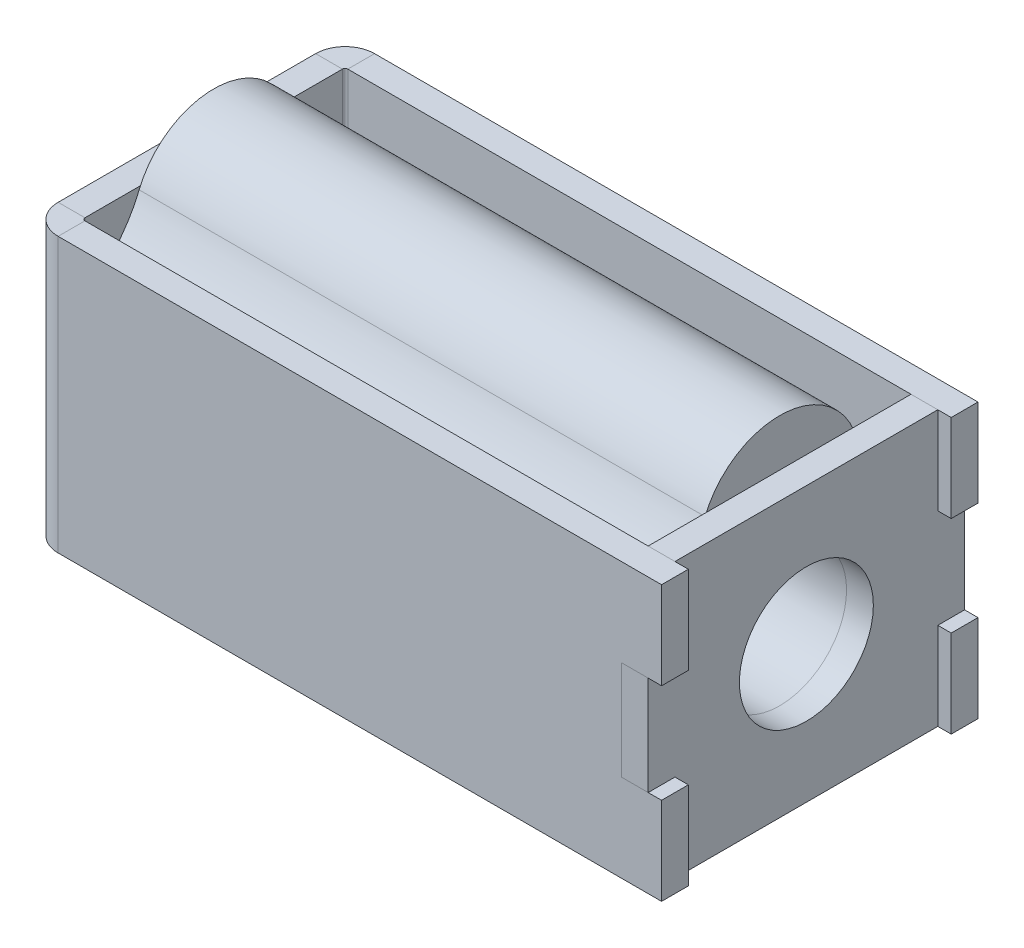
from build123d import *

# Parameters (mm, degrees)
T_LE_DE_BASE_PLI_E1_DEPTH = 6.5
ESQUISSE6_W               = 1.27
ESQUISSE6_H               = 4.699
ENL_V_MAT_EXTRU_1_DEPTH   = 1.905
BOSS_EXTRU_1_DEPTH        = 1.27
BOSS_EXTRU_2_DEPTH        = 26.825
CONG_1_R                  = 6.35
ESQUISSE13_R              = 1.651
ENL_V_MAT_EXTRU_2_DEPTH   = 33.134679114
BOSS_EXTRU_3_START        = 0.381
ESQUISSE14_R              = 2.4765
ESQUISSE14_R_2            = 1.651
BOSS_EXTRU_3_DEPTH        = 0.381
ESQUISSE15_R              = 3.175
ENL_V_MAT_EXTRU_3_DEPTH   = 20
ESQUISSE19_R              = 1.143
ENL_V_MAT_EXTRU_7_DEPTH   = 1.27


# Read off the part's stored shape, not the designer's step: Boss.-Extru.2
# Sheet-metal steps are written as plain solids
with BuildPart() as part:
    # Esquisse1 → Tôle de base pliée1 (new, symmetric)
    with BuildSketch(Plane(origin=(0, 0, 0), x_dir=(1, 0, 0), z_dir=(0, 1, 0))):
        with BuildLine():
            Line((15, 7.5), (-13.603, 7.5))
            ThreePointArc((-13.603, 7.5), (-14.590828173, 7.090828173), (-15, 6.103))
            Line((-15, 6.103), (-15, -6.103))
            ThreePointArc((-15, -6.103), (-14.590828173, -7.090828173), (-13.603, -7.5))
            Line((-13.603, -7.5), (15, -7.5))
            Line((15, -7.5), (15, -6.23))
            Line((15, -6.23), (-13.603, -6.23))
            ThreePointArc((-13.603, -6.23), (-13.692802561, -6.192802561), (-13.73, -6.103))
            Line((-13.73, -6.103), (-13.73, 6.103))
            ThreePointArc((-13.73, 6.103), (-13.692802561, 6.192802561), (-13.603, 6.23))
            Line((-13.603, 6.23), (15, 6.23))
            Line((15, 6.23), (15, 7.5))
        make_face()
    extrude(amount=T_LE_DE_BASE_PLI_E1_DEPTH, both=True)

    # Esquisse6 → Enlèv. mat.-Extru.1 (cut)
    with BuildSketch(Plane(origin=(15, 0, 0), x_dir=(0, 0, -1), z_dir=(1, 0, 0))):
        with Locations((-6.865, 0)):
            Rectangle(ESQUISSE6_W, ESQUISSE6_H)
        with Locations((6.865, 0)):
            Rectangle(ESQUISSE6_W, ESQUISSE6_H)
    extrude(amount=-ENL_V_MAT_EXTRU_1_DEPTH, mode=Mode.SUBTRACT)


with BuildPart() as body_2:
    # Esquisse7 → Boss.-Extru.1 (new body)
    with BuildSketch(Plane(origin=(13.095, 0, 0), x_dir=(0, 0, -1), z_dir=(1, 0, 0))):
        Polygon((-7.5, 2.3495), (-6.23, 2.3495), (-6.23, 6.5), (6.23, 6.5), (6.23, 2.3495), (7.5, 2.3495), (7.5, -2.3495), (6.23, -2.3495), (6.23, -6.5), (-6.23, -6.5), (-6.23, -2.3495), (-7.5, -2.3495), align=None)
    extrude(amount=BOSS_EXTRU_1_DEPTH)


with BuildPart() as body_3:
    # Boss.-Extru.2 outline → Boss.-Extru.2 (new body)
    with BuildSketch(Plane(origin=(-13.73, 0, 0), x_dir=(0, 0, -1), z_dir=(1, 0, 0))):
        with BuildLine():
            ThreePointArc((6.103, 2.2368261), (5.176867338, 3.93065447), (3.794095002, 5.277768763))
            ThreePointArc((3.794095002, 5.277768763), (0, 8.74), (-3.794095002, 5.277768763))
            ThreePointArc((-3.794095002, 5.277768763), (-5.176867338, 3.93065447), (-6.103, 2.2368261))
            Line((-6.103, 2.2368261), (-6.103, -2.2368261))
            ThreePointArc((-6.103, -2.2368261), (0, -6.5), (6.103, -2.2368261))
            Line((6.103, -2.2368261), (6.103, 2.2368261))
        make_face()
    extrude(amount=BOSS_EXTRU_2_DEPTH)

    # Congé1
    cong_1_edges = [body_3.edges().sort_by_distance(p)[0] for p in [
        (-0.3175, 5.277768763, -3.794095002),
        (-0.3175, 5.277768763, 3.794095002),
    ]]
    fillet(cong_1_edges, radius=CONG_1_R)


with BuildPart() as enl_v_mat_extru_2_tool:
    # Esquisse13 → Enlèv. mat.-Extru.2 (new, through all)
    with BuildSketch(Plane.ZY.offset(15)):
        Circle(ESQUISSE13_R)
    extrude(amount=-ENL_V_MAT_EXTRU_2_DEPTH)


with BuildPart() as part_1:
    add(part.part)

    # Enlèv. mat.-Extru.2: cut by enl_v_mat_extru_2_tool
    add(enl_v_mat_extru_2_tool.part, mode=Mode.SUBTRACT)

    # Esquisse14 → Boss.-Extru.3 (add)
    with BuildSketch(Plane.ZY.offset(15).offset(BOSS_EXTRU_3_START)):
        with Locations(Location((0, 0, 0), (0, 0, 180))):
            Circle(ESQUISSE14_R)
        Circle(ESQUISSE14_R_2, mode=Mode.SUBTRACT)
    extrude(amount=-BOSS_EXTRU_3_DEPTH)

    # Esquisse19 → Enlèv. mat.-Extru.7 (cut)
    with BuildSketch(Plane(origin=(0, 0, -7.5), x_dir=(-1, 0, 0), z_dir=(0, 0, -1))):
        with Locations((-7.5, 0)):
            Circle(ESQUISSE19_R)
        with Locations((7.5, 0)):
            Circle(ESQUISSE19_R)
    extrude(amount=-ENL_V_MAT_EXTRU_7_DEPTH, mode=Mode.SUBTRACT)


with BuildPart() as body_2_1:
    add(body_2.part)

    # Enlèv. mat.-Extru.2: cut by enl_v_mat_extru_2_tool
    add(enl_v_mat_extru_2_tool.part, mode=Mode.SUBTRACT)


with BuildPart() as body_3_1:
    add(body_3.part)

    # Enlèv. mat.-Extru.2: cut by enl_v_mat_extru_2_tool
    add(enl_v_mat_extru_2_tool.part, mode=Mode.SUBTRACT)


with BuildPart() as enl_v_mat_extru_3_tool:
    # Esquisse15 → Enlèv. mat.-Extru.3 (new body)
    with BuildSketch(Plane(origin=(14.365, 0, 0), x_dir=(0, 0, -1), z_dir=(1, 0, 0))):
        Circle(ESQUISSE15_R)
    extrude(amount=-ENL_V_MAT_EXTRU_3_DEPTH)


with BuildPart() as body_2_2:
    add(body_2_1.part)

    # Enlèv. mat.-Extru.3: cut by enl_v_mat_extru_3_tool
    add(enl_v_mat_extru_3_tool.part, mode=Mode.SUBTRACT)


with BuildPart() as body_3_2:
    add(body_3_1.part)

    # Enlèv. mat.-Extru.3: cut by enl_v_mat_extru_3_tool
    add(enl_v_mat_extru_3_tool.part, mode=Mode.SUBTRACT)


solid = Compound([part_1.part, body_2_2.part, body_3_2.part])
